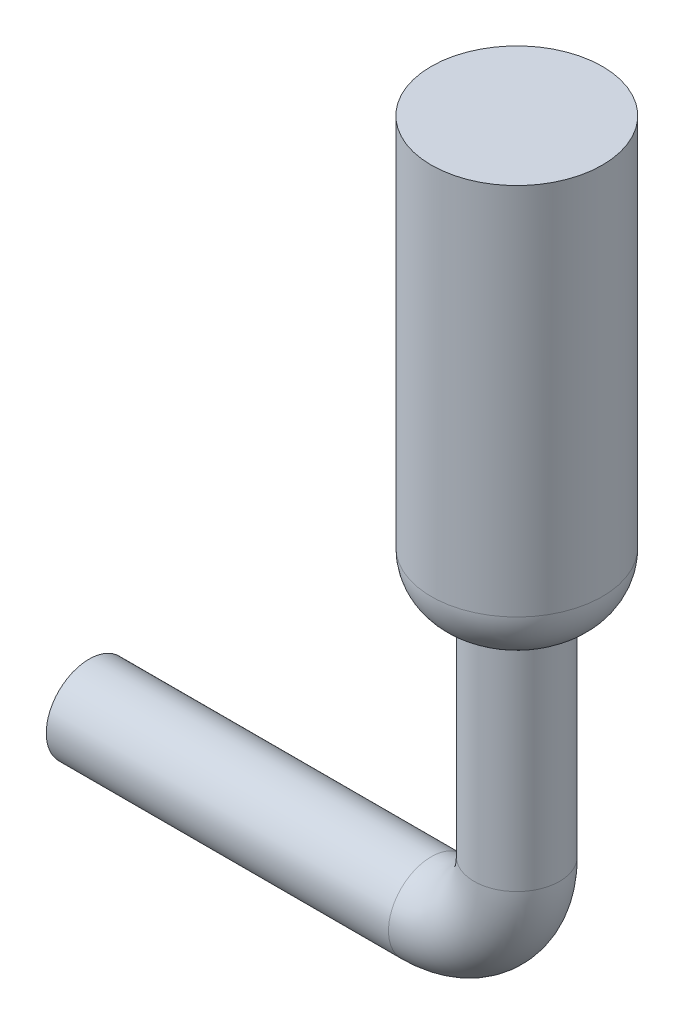
from build123d import *

# Parameters (mm, degrees)
SWEEP1_PROFILE_R    = 12.7
SKETCH2_R           = 25.4
BOSS_EXTRUDE1_DEPTH = 127
FILLET1_R           = 16.51


with BuildPart() as part:
    # Sweep1: sweep along a path in Sketch1
    with BuildLine(Plane.XY) as sweep1_path:
        Line((-127, 0), (-25.4, 0))
        ThreePointArc((-25.4, 0), (-7.439487758, 7.439487758), (0, 25.4))
        Line((0, 25.4), (0, 88.9))
    # Sweep1 profile (on start of the path) → Sweep1 (sweep)
    with BuildSketch(Plane.YZ.offset(-127)):
        Circle(SWEEP1_PROFILE_R)
    sweep(path=sweep1_path.line)

    # Sketch2 → Boss-Extrude1 (add)
    with BuildSketch(Plane(origin=(0, 88.9, 0), x_dir=(1, 0, 0), z_dir=(0, 1, 0))):
        with Locations(Location((0, 0, 0), (0, 0, 270))):
            Circle(SKETCH2_R)
    extrude(amount=BOSS_EXTRUDE1_DEPTH)

    # Fillet1
    # the kernel refuses this fillet: 16.51 mm, written as the material it takes off along each edge
    with BuildSketch(Plane(origin=(0, 88.9, 0), x_dir=(0, 0, 1), z_dir=(-1, 0, 0))) as fillet1_piece_1:
        with BuildLine():
            CenterArc((8.89, 16.064370514), FILLET1_R, 283.342363797, 76.657636203)
            Line((12.7, 0), (12.7762, -0.32128741))
            ThreePointArc((12.7762, -0.32128741), (19.05, -0.3302), (25.4, -0.3302))
            Line((25.4, -0.3302), (25.7302, 0))
            Line((25.7302, 0), (25.7302, 16.064370514))
            Line((25.7302, 16.064370514), (25.4, 16.064370514))
        make_face()
    revolve(axis=Axis((0, 88.9, 0), (0, 1, 0)), mode=Mode.SUBTRACT)


solid = part.part
